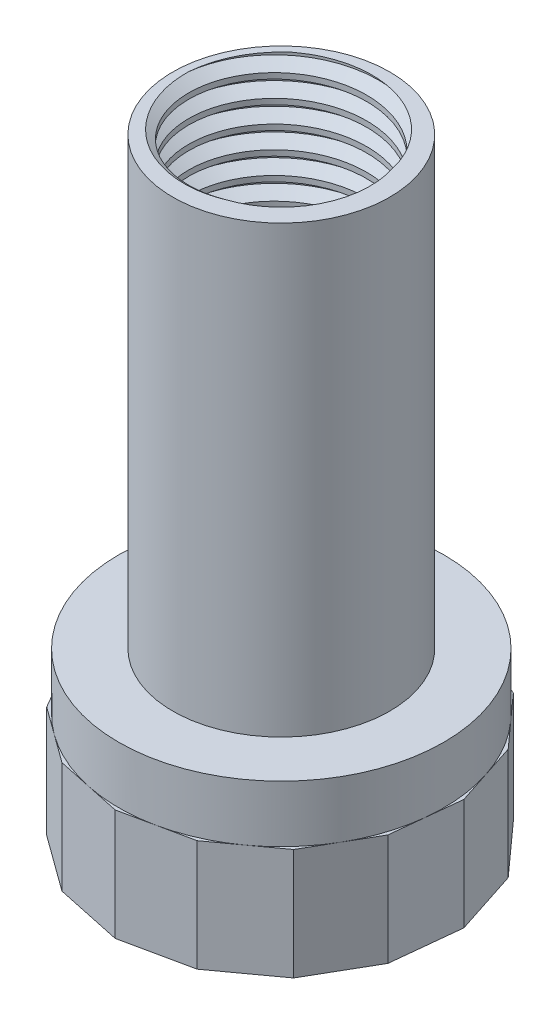
from build123d import *

# Parameters (mm, degrees)
THREAD1_PITCH       = 2
BOSS_EXTRUDE3_START = -10
BOSS_EXTRUDE3_DEPTH = 10


with BuildPart() as part:
    # Sketch1 → Revolve1 (revolve)
    with BuildSketch(Plane.XY, mode=Mode.PRIVATE) as revolve1_sk:
        Polygon((-8, 55.1), (-8, 0), (-14.6, 0), (-14.6, 15.1), (-9.75, 15.1), (-9.75, 55.1), align=None)
    revolve(revolve1_sk.sketch.rotate(Axis((0, 0, 0), (0, 1, 0)), 270), axis=Axis((0, 0, 0), (0, 1, 0)))

    # Thread1: arcs per turn and ends read off the stored shape
    # Thread1: the profile of Thread Profile1 profile screwed along a right-hand helix through 32.5 turns, 10 arcs to a turn; built about Z, then put on its axis
    thread1_z = Axis((0, 0, 0), (0, 0, 1))
    thread1_corners = [(7.9997, 0, -0.000173205), (9.08253175, 0, 0.624999997), (9.08253175, 0, 0.874999997), (7.9997, 0, 1.5001732)]
    with BuildLine(mode=Mode.PRIVATE) as thread1_profile:
        Line(thread1_corners[0], thread1_corners[1])
        Line(thread1_corners[1], thread1_corners[2])
        Line(thread1_corners[2], thread1_corners[3])
        Line(thread1_corners[3], thread1_corners[0])
    thread1_cap = Face(thread1_profile.wire())
    thread1_turn_angles = [0, 18, 36, 54, 72, 90, 108, 126, 144, 162, 180, 198, 216, 234, 252, 270, 288, 306, 324, 342, 360]
    thread1_turn_weights = [1, 0.9510565162951535, 1, 0.9510565162951535, 1, 0.9510565162951535, 1, 0.9510565162951535, 1, 0.9510565162951535, 1, 0.9510565162951535, 1, 0.9510565162951535, 1, 0.9510565162951535, 1, 0.9510565162951535, 1, 0.9510565162951535, 1]
    thread1_turn_rails = [Edge.make_bspline([Vector(p[0], p[1], 0).rotate(thread1_z, thread1_turn_angles[k]) / thread1_turn_weights[k] + Vector(0, 0, p[2] + THREAD1_PITCH * thread1_turn_angles[k] / 360) for k in range(21)], [0, 0, 0, 1, 1, 2, 2, 3, 3, 4, 4, 5, 5, 6, 6, 7, 7, 8, 8, 9, 9, 10, 10, 10], 2, thread1_turn_weights) for p in thread1_corners]
    thread1_turn_sides = [Face.make_surface_from_curves(thread1_turn_rails[p[0]], thread1_turn_rails[p[1]]) for p in [(0, 1), (1, 2), (2, 3), (3, 0)]]
    thread1_last_angles = [11520, 11538, 11556, 11574, 11592, 11610, 11628, 11646, 11664, 11682, 11700]
    thread1_last_weights = [1, 0.9510565162951535, 1, 0.9510565162951535, 1, 0.9510565162951535, 1, 0.9510565162951535, 1, 0.9510565162951535, 1]
    thread1_last_rails = [Edge.make_bspline([Vector(p[0], p[1], 0).rotate(thread1_z, thread1_last_angles[k]) / thread1_last_weights[k] + Vector(0, 0, p[2] + THREAD1_PITCH * thread1_last_angles[k] / 360) for k in range(11)], [0, 0, 0, 1, 1, 2, 2, 3, 3, 4, 4, 5, 5, 5], 2, thread1_last_weights) for p in thread1_corners]
    thread1_last_sides = [Face.make_surface_from_curves(thread1_last_rails[p[0]], thread1_last_rails[p[1]]) for p in [(0, 1), (1, 2), (2, 3), (3, 0)]]
    thread1 = Plane(origin=(0, -2.5, 0), x_dir=(1, 0, 0), z_dir=(0, 1, 0)) * Solid(Shell([*[p.moved(Location((0, 0, THREAD1_PITCH * i))) for i in range(32) for p in thread1_turn_sides], *thread1_last_sides, thread1_cap, thread1_cap.rotate(thread1_z, 11700).moved(Location((0, 0, THREAD1_PITCH * 11700 / 360)))]))
    add(thread1, mode=Mode.SUBTRACT)

    # Sketch5 → Boss-Extrude3 (add)
    with BuildSketch(Plane.XZ.offset(BOSS_EXTRUDE3_START)):
        with BuildLine():
            Line((-14.844405549, -1.560209893), (-13.88542516, -4.51164805))
            ThreePointArc((-13.88542516, -4.51164805), (-14.520019682, -1.526115476), (-14.520019661, 1.526115667))
            Line((-14.520019661, 1.526115667), (-14.844405549, -1.560209893))
        make_face()
        with BuildLine():
            Line((-14.195633795, 4.612441021), (-14.520019661, 1.526115667))
            ThreePointArc((-14.520019661, 1.526115667), (-13.885425107, 4.511648211), (-12.643970849, 7.30000008))
            Line((-12.643970849, 7.30000008), (-14.195633795, 4.612441021))
        make_face()
        with BuildLine():
            Line((-11.092307995, 9.987558979), (-12.643970849, 7.30000008))
            ThreePointArc((-12.643970849, 7.30000008), (-10.849914372, 9.769306942), (-8.581664564, 11.811648204))
            Line((-8.581664564, 11.811648204), (-11.092307995, 9.987558979))
        make_face()
        with BuildLine():
            Line((-6.071021372, 13.635737256), (-8.581664564, 11.811648204))
            ThreePointArc((-8.581664564, 11.811648204), (-5.938354956, 13.337763696), (-3.03551076, 14.280954955))
            Line((-3.03551076, 14.280954955), (-6.071021372, 13.635737256))
        make_face()
        with BuildLine():
            Line((3.035510595, 14.28095499), (0, 14.926172685))
            Line((0, 14.926172685), (0, 14.6))
            ThreePointArc((0, 14.6), (1.526115517, 14.520019677), (3.035510595, 14.28095499))
        make_face()
        with BuildLine():
            Line((0, 14.926172685), (-3.03551076, 14.280954955))
            ThreePointArc((-3.03551076, 14.280954955), (-1.526115601, 14.520019668), (0, 14.6))
            Line((0, 14.6), (0, 14.926172685))
        make_face()
        with BuildLine():
            Line((6.071021372, 13.635737256), (3.035510595, 14.28095499))
            ThreePointArc((3.035510595, 14.28095499), (5.938354958, 13.337763695), (8.581664704, 11.811648103))
            Line((8.581664704, 11.811648103), (6.071021372, 13.635737256))
        make_face()
        with BuildLine():
            Line((11.092307995, 9.987558979), (8.581664704, 11.811648103))
            ThreePointArc((8.581664704, 11.811648103), (10.849914487, 9.769306814), (12.643970935, 7.29999993))
            Line((12.643970935, 7.29999993), (11.092307995, 9.987558979))
        make_face()
        with BuildLine():
            ThreePointArc((12.643970935, 7.29999993), (13.885425143, 4.511648103), (14.520019667, 1.526115612))
            Line((14.520019667, 1.526115612), (14.195633795, 4.612441021))
            Line((14.195633795, 4.612441021), (12.643970935, 7.29999993))
        make_face()
        with BuildLine():
            ThreePointArc((14.6, 0), (14.420249774, -2.283943178), (13.885425145, -4.511648097))
            Line((13.885425145, -4.511648097), (14.844405549, -1.560209893))
            Line((14.844405549, -1.560209893), (14.520019667, 1.526115612))
            ThreePointArc((14.520019667, 1.526115612), (14.579991206, 0.764104986), (14.6, 0))
        make_face()
        with BuildLine():
            ThreePointArc((10.849914296, -9.769307026), (8.581664552, -11.811648213), (5.938354905, -13.337763719))
            Line((5.938354905, -13.337763719), (8.773384177, -12.075527363))
            Line((8.773384177, -12.075527363), (10.849914296, -9.769307026))
        make_face()
        with BuildLine():
            ThreePointArc((13.885425145, -4.511648097), (12.643970843, -7.300000091), (10.849914296, -9.769307026))
            Line((10.849914296, -9.769307026), (12.926444727, -7.463086343))
            Line((12.926444727, -7.463086343), (13.885425145, -4.511648097))
        make_face()
        with BuildLine():
            ThreePointArc((5.938354905, -13.337763719), (3.035510641, -14.28095498), (0, -14.6))
            Line((0, -14.6), (3.1033258, -14.6))
            Line((3.1033258, -14.6), (5.938354905, -13.337763719))
        make_face()
        with BuildLine():
            ThreePointArc((0, -14.6), (-3.035510664, -14.280954975), (-5.938354948, -13.3377637))
            Line((-5.938354948, -13.3377637), (-3.1033258, -14.6))
            Line((-3.1033258, -14.6), (0, -14.6))
        make_face()
        with BuildLine():
            ThreePointArc((-5.938354948, -13.3377637), (-8.581664698, -11.811648107), (-10.849914506, -9.769306793))
            Line((-10.849914506, -9.769306793), (-8.773384177, -12.075527363))
            Line((-8.773384177, -12.075527363), (-5.938354948, -13.3377637))
        make_face()
        with BuildLine():
            Line((-13.88542516, -4.51164805), (-12.926444727, -7.463086343))
            Line((-12.926444727, -7.463086343), (-10.849914506, -9.769306793))
            ThreePointArc((-10.849914506, -9.769306793), (-12.643970933, -7.299999934), (-13.88542516, -4.51164805))
        make_face()
    extrude(amount=BOSS_EXTRUDE3_DEPTH)


solid = part.part
